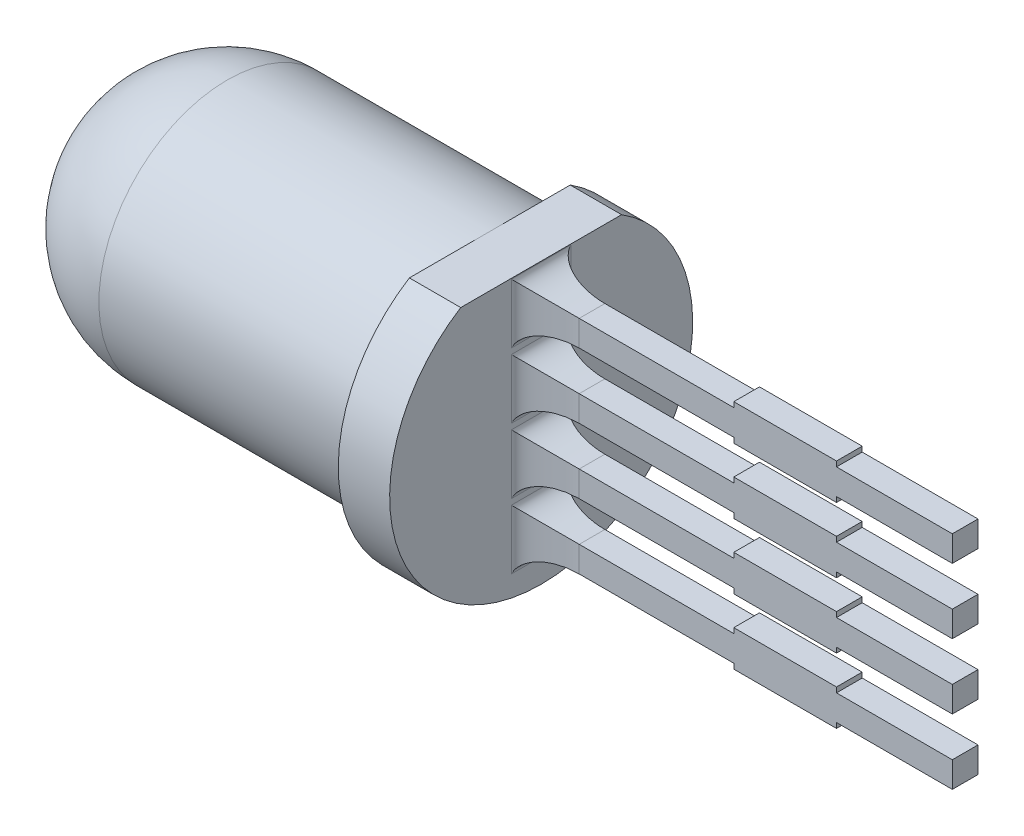
from build123d import *

# Parameters (mm, degrees)
CUT_EXTRUDE1_DEPTH              = 10.568042243
SKETCH3_W                       = 0.5
SKETCH3_H                       = 0.5
BOSS_EXTRUDE1_DEPTH             = 24.5
CUT_EXTRUDE2_DEPTH              = 25.852665853
CUT_EXTRUDE2_DEPTH_BACK         = 25.852665853
SKETCH4_W                       = 2.5
SKETCH4_H                       = 0.5
SKETCH4_W_2                     = 1
BOSS_EXTRUDE2_REACH             = 26.853
SKETCH6_W                       = 2
SKETCH6_H                       = 0.7
BOSS_EXTRUDE2_DIRECTION_2_REACH = 26.853
FILLET1_START                   = -2.4852001
FILLET1_DEPTH                   = 1.1604002
FILLET1_START_2                 = -1.2152001
FILLET1_2_DEPTH                 = 1.1604002
FILLET1_START_3                 = 0.0547999
FILLET1_3_DEPTH                 = 1.1604002
FILLET1_START_4                 = 1.3247999
FILLET1_4_DEPTH                 = 1.1604002
FILLET1_START_5                 = -2.95
FILLET1_5_DEPTH                 = 5.9
FILLET1_START_6                 = -0.25
FILLET1_6_DEPTH                 = 0.5
CUT_EXTRUDE3_DEPTH              = 25.852665853
CUT_EXTRUDE3_DEPTH_BACK         = 25.852665853
SKETCH7_W                       = 16.245
SKETCH7_H                       = 4.51


with BuildPart() as part:
    # Sketch1 → Revolve1 (revolve)
    with BuildSketch(Plane.XY, mode=Mode.PRIVATE) as revolve1_sk:
        with BuildLine():
            Line((0, 0), (0, 2.95))
            Line((0, 2.95), (-1, 2.95))
            Line((-1, 2.95), (-1, 2.5))
            Line((-1, 2.5), (-6.1106, 2.5))
            ThreePointArc((-6.1106, 2.5), (-7.878366953, 1.767766953), (-8.6106, 0))
            Line((-8.6106, 0), (0, 0))
        make_face()
    revolve(revolve1_sk.sketch.rotate(Axis((0, 0, 0), (-1, 0, 0)), 90), axis=Axis((0, 0, 0), (-1, 0, 0)))

    # Sketch2 → Cut-Extrude1 (cut, through all)
    with BuildSketch(Plane(origin=(0, 0, 0), x_dir=(0, 0, -1), z_dir=(1, 0, 0))):
        with BuildLine():
            Line((-1.566045976, 2.5), (1.566045976, 2.5))
            ThreePointArc((1.566045976, 2.5), (0, 2.95), (-1.566045976, 2.5))
        make_face()
    extrude(amount=-CUT_EXTRUDE1_DEPTH, mode=Mode.SUBTRACT)

    # Sketch3 → Boss-Extrude1 (add)
    with BuildSketch(Plane(origin=(0, 0, 0), x_dir=(0, 0, -1), z_dir=(1, 0, 0))):
        with Locations((0, 1.905)):
            Rectangle(SKETCH3_W, SKETCH3_H)
        with Locations((0, 0.635)):
            Rectangle(SKETCH3_W, SKETCH3_H)
        with Locations((0, -0.635)):
            Rectangle(SKETCH3_W, SKETCH3_H)
        with Locations((0, -1.905)):
            Rectangle(SKETCH3_W, SKETCH3_H)
    extrude(amount=BOSS_EXTRUDE1_DEPTH)

    # Sketch4 → Cut-Extrude2 (cut, two sides: drawn at the far end of the back side and taken through both)
    with BuildSketch(Plane.XY.offset(-CUT_EXTRUDE2_DEPTH_BACK)):
        with Locations((23.25, 1.905)):
            Rectangle(SKETCH4_W, SKETCH4_H)
        with Locations((24, -0.635)):
            Rectangle(SKETCH4_W_2, SKETCH4_H)
        with Locations((23.25, -1.905)):
            Rectangle(SKETCH4_W, SKETCH4_H)
    extrude(amount=CUT_EXTRUDE2_DEPTH + CUT_EXTRUDE2_DEPTH_BACK, mode=Mode.SUBTRACT)

    # Boss-Extrude2: up to this face of the body (flat: up to its plane)
    boss_extrude2_end = Plane(part.part.faces().sort_by_distance((11, 1.905, 0.25))[0])
    # Sketch6 → Boss-Extrude2 (add, up to the picked face)
    with BuildSketch(Plane.XY, mode=Mode.PRIVATE) as boss_extrude2_sk1:
        with Locations((5, 1.905)):
            Rectangle(SKETCH6_W, SKETCH6_H)
    boss_extrude2_tool1 = split(extrude(boss_extrude2_sk1.sketch, amount=BOSS_EXTRUDE2_REACH, mode=Mode.PRIVATE), bisect_by=boss_extrude2_end, keep=Keep.BOTH, mode=Mode.PRIVATE)
    # Sketch6 → Boss-Extrude2 (add, up to the picked face)
    with BuildSketch(Plane.XY, mode=Mode.PRIVATE) as boss_extrude2_sk2:
        with Locations((5, 0.635)):
            Rectangle(SKETCH6_W, SKETCH6_H)
    boss_extrude2_tool2 = split(extrude(boss_extrude2_sk2.sketch, amount=BOSS_EXTRUDE2_REACH, mode=Mode.PRIVATE), bisect_by=boss_extrude2_end, keep=Keep.BOTH, mode=Mode.PRIVATE)
    # Sketch6 → Boss-Extrude2 (add, up to the picked face)
    with BuildSketch(Plane.XY, mode=Mode.PRIVATE) as boss_extrude2_sk3:
        with Locations((5, -0.635)):
            Rectangle(SKETCH6_W, SKETCH6_H)
    boss_extrude2_tool3 = split(extrude(boss_extrude2_sk3.sketch, amount=BOSS_EXTRUDE2_REACH, mode=Mode.PRIVATE), bisect_by=boss_extrude2_end, keep=Keep.BOTH, mode=Mode.PRIVATE)
    # Sketch6 → Boss-Extrude2 (add, up to the picked face)
    with BuildSketch(Plane.XY, mode=Mode.PRIVATE) as boss_extrude2_sk4:
        with Locations((5, -1.905)):
            Rectangle(SKETCH6_W, SKETCH6_H)
    boss_extrude2_tool4 = split(extrude(boss_extrude2_sk4.sketch, amount=BOSS_EXTRUDE2_REACH, mode=Mode.PRIVATE), bisect_by=boss_extrude2_end, keep=Keep.BOTH, mode=Mode.PRIVATE)
    add(boss_extrude2_tool1.solids().sort_by(Axis((5, 1.905, 0), (0, 0, 1)))[0])
    add(boss_extrude2_tool2.solids().sort_by(Axis((5, 0.635, 0), (0, 0, 1)))[0])
    add(boss_extrude2_tool3.solids().sort_by(Axis((5, -0.635, 0), (0, 0, 1)))[0])
    add(boss_extrude2_tool4.solids().sort_by(Axis((5, -1.905, 0), (0, 0, 1)))[0])

    # Boss-Extrude2 direction 2: up to this face of the body (flat: up to its plane)
    boss_extrude2_direction_2_end = Plane(part.part.faces().sort_by_distance((11, 1.905, -0.25))[0])
    # Sketch6 → Boss-Extrude2 direction 2 (add, up to the picked face)
    with BuildSketch(Plane.XY, mode=Mode.PRIVATE) as boss_extrude2_direction_2_sk1:
        with Locations((5, 1.905)):
            Rectangle(SKETCH6_W, SKETCH6_H)
    boss_extrude2_direction_2_tool1 = split(extrude(boss_extrude2_direction_2_sk1.sketch, amount=-BOSS_EXTRUDE2_DIRECTION_2_REACH, mode=Mode.PRIVATE), bisect_by=boss_extrude2_direction_2_end, keep=Keep.BOTH, mode=Mode.PRIVATE)
    # Sketch6 → Boss-Extrude2 direction 2 (add, up to the picked face)
    with BuildSketch(Plane.XY, mode=Mode.PRIVATE) as boss_extrude2_direction_2_sk2:
        with Locations((5, 0.635)):
            Rectangle(SKETCH6_W, SKETCH6_H)
    boss_extrude2_direction_2_tool2 = split(extrude(boss_extrude2_direction_2_sk2.sketch, amount=-BOSS_EXTRUDE2_DIRECTION_2_REACH, mode=Mode.PRIVATE), bisect_by=boss_extrude2_direction_2_end, keep=Keep.BOTH, mode=Mode.PRIVATE)
    # Sketch6 → Boss-Extrude2 direction 2 (add, up to the picked face)
    with BuildSketch(Plane.XY, mode=Mode.PRIVATE) as boss_extrude2_direction_2_sk3:
        with Locations((5, -0.635)):
            Rectangle(SKETCH6_W, SKETCH6_H)
    boss_extrude2_direction_2_tool3 = split(extrude(boss_extrude2_direction_2_sk3.sketch, amount=-BOSS_EXTRUDE2_DIRECTION_2_REACH, mode=Mode.PRIVATE), bisect_by=boss_extrude2_direction_2_end, keep=Keep.BOTH, mode=Mode.PRIVATE)
    # Sketch6 → Boss-Extrude2 direction 2 (add, up to the picked face)
    with BuildSketch(Plane.XY, mode=Mode.PRIVATE) as boss_extrude2_direction_2_sk4:
        with Locations((5, -1.905)):
            Rectangle(SKETCH6_W, SKETCH6_H)
    boss_extrude2_direction_2_tool4 = split(extrude(boss_extrude2_direction_2_sk4.sketch, amount=-BOSS_EXTRUDE2_DIRECTION_2_REACH, mode=Mode.PRIVATE), bisect_by=boss_extrude2_direction_2_end, keep=Keep.BOTH, mode=Mode.PRIVATE)
    add(boss_extrude2_direction_2_tool1.solids().sort_by(Axis((5, 1.905, 0), (0, 0, -1)))[0])
    add(boss_extrude2_direction_2_tool2.solids().sort_by(Axis((5, 0.635, 0), (0, 0, -1)))[0])
    add(boss_extrude2_direction_2_tool3.solids().sort_by(Axis((5, -0.635, 0), (0, 0, -1)))[0])
    add(boss_extrude2_direction_2_tool4.solids().sort_by(Axis((5, -1.905, 0), (0, 0, -1)))[0])

    # Fillet1: read off the stored shape, not the designer's step
    # Fillet1 outline → Fillet1 (add)
    with BuildSketch(Plane(origin=(0, 0, 0), x_dir=(1, 0, 0), z_dir=(0, 1, 0)).offset(FILLET1_START)):
        with BuildLine():
            Line((0, 0.5802), (0, 0.25))
            Line((0, 0.25), (0.9906, 0.25))
            add(Edge.make_bspline(
                [(0.9906, 0.25), (0, 0.25), (0, 0.5802)],
                knots=[0, 0, 0, 1, 1, 1], degree=2, weights=[1, 0.707106781, 1]))
        make_face()
        with BuildLine():
            add(Edge.make_bspline(
                [(0.9906, -0.25), (0, -0.25), (0, -0.5802)],
                knots=[0, 0, 0, 1, 1, 1], degree=2, weights=[1, 0.707106781, 1]))
            Line((0.9906, -0.25), (0, -0.25))
            Line((0, -0.25), (0, -0.5802))
        make_face()
    extrude(amount=FILLET1_DEPTH)

    # Fillet1 2 outline → Fillet1 2 (add)
    with BuildSketch(Plane(origin=(0, 0, 0), x_dir=(1, 0, 0), z_dir=(0, 1, 0)).offset(FILLET1_START_2)):
        with BuildLine():
            Line((0, 0.5802), (0, 0.25))
            Line((0, 0.25), (0.9906, 0.25))
            add(Edge.make_bspline(
                [(0.9906, 0.25), (0, 0.25), (0, 0.5802)],
                knots=[0, 0, 0, 1, 1, 1], degree=2, weights=[1, 0.707106781, 1]))
        make_face()
        with BuildLine():
            add(Edge.make_bspline(
                [(0.9906, -0.25), (0, -0.25), (0, -0.5802)],
                knots=[0, 0, 0, 1, 1, 1], degree=2, weights=[1, 0.707106781, 1]))
            Line((0.9906, -0.25), (0, -0.25))
            Line((0, -0.25), (0, -0.5802))
        make_face()
    extrude(amount=FILLET1_2_DEPTH)

    # Fillet1 3 outline → Fillet1 3 (add)
    with BuildSketch(Plane(origin=(0, 0, 0), x_dir=(1, 0, 0), z_dir=(0, 1, 0)).offset(FILLET1_START_3)):
        with BuildLine():
            Line((0, 0.5802), (0, 0.25))
            Line((0, 0.25), (0.9906, 0.25))
            add(Edge.make_bspline(
                [(0.9906, 0.25), (0, 0.25), (0, 0.5802)],
                knots=[0, 0, 0, 1, 1, 1], degree=2, weights=[1, 0.707106781, 1]))
        make_face()
        with BuildLine():
            add(Edge.make_bspline(
                [(0.9906, -0.25), (0, -0.25), (0, -0.5802)],
                knots=[0, 0, 0, 1, 1, 1], degree=2, weights=[1, 0.707106781, 1]))
            Line((0.9906, -0.25), (0, -0.25))
            Line((0, -0.25), (0, -0.5802))
        make_face()
    extrude(amount=FILLET1_3_DEPTH)

    # Fillet1 4 outline → Fillet1 4 (add)
    with BuildSketch(Plane(origin=(0, 0, 0), x_dir=(1, 0, 0), z_dir=(0, 1, 0)).offset(FILLET1_START_4)):
        with BuildLine():
            Line((0, 0.5802), (0, 0.25))
            Line((0, 0.25), (0.9906, 0.25))
            add(Edge.make_bspline(
                [(0.9906, 0.25), (0, 0.25), (0, 0.5802)],
                knots=[0, 0, 0, 1, 1, 1], degree=2, weights=[1, 0.707106781, 1]))
        make_face()
        with BuildLine():
            add(Edge.make_bspline(
                [(0.9906, -0.25), (0, -0.25), (0, -0.5802)],
                knots=[0, 0, 0, 1, 1, 1], degree=2, weights=[1, 0.707106781, 1]))
            Line((0.9906, -0.25), (0, -0.25))
            Line((0, -0.25), (0, -0.5802))
        make_face()
    extrude(amount=FILLET1_4_DEPTH)

    # Fillet1 5 outline → Fillet1 5 (cut)
    with BuildSketch(Plane.XY.offset(FILLET1_START_5)):
        with BuildLine():
            add(Edge.make_bspline(
                [(0.9906, -1.655), (0, -1.655), (0, -1.3248)],
                knots=[0, 0, 0, 1, 1, 1], degree=2, weights=[1, 0.707106781, 1]))
            Line((0.9906, -1.655), (2, -1.655))
            Line((2, -1.655), (2, -0.885))
            Line((2, -0.885), (0.9906, -0.885))
            add(Edge.make_bspline(
                [(0.9906, -0.885), (0, -0.885), (0, -1.2152)],
                knots=[0, 0, 0, 1, 1, 1], degree=2, weights=[1, 0.707106781, 1]))
            Line((0, -1.2152), (0, -1.3248))
        make_face()
        with BuildLine():
            Line((2, -4), (2, -2.155))
            Line((2, -2.155), (0.9906, -2.155))
            add(Edge.make_bspline(
                [(0.9906, -2.155), (0, -2.155), (0, -2.4852)],
                knots=[0, 0, 0, 1, 1, 1], degree=2, weights=[1, 0.707106781, 1]))
            Line((0, -2.4852), (0, -4))
            Line((0, -4), (2, -4))
        make_face()
        with BuildLine():
            Line((0.9906, -0.385), (2, -0.385))
            Line((2, -0.385), (2, 0.385))
            Line((2, 0.385), (0.9906, 0.385))
            add(Edge.make_bspline(
                [(0.9906, 0.385), (0, 0.385), (0, 0.0548)],
                knots=[0, 0, 0, 1, 1, 1], degree=2, weights=[1, 0.707106781, 1]))
            Line((0, 0.0548), (0, -0.0548))
            add(Edge.make_bspline(
                [(0.9906, -0.385), (0, -0.385), (0, -0.0548)],
                knots=[0, 0, 0, 1, 1, 1], degree=2, weights=[1, 0.707106781, 1]))
        make_face()
        with BuildLine():
            Line((0.9906, 0.885), (2, 0.885))
            Line((2, 0.885), (2, 1.655))
            Line((2, 1.655), (0.9906, 1.655))
            add(Edge.make_bspline(
                [(0.9906, 1.655), (0, 1.655), (0, 1.3248)],
                knots=[0, 0, 0, 1, 1, 1], degree=2, weights=[1, 0.707106781, 1]))
            Line((0, 1.3248), (0, 1.2152))
            add(Edge.make_bspline(
                [(0.9906, 0.885), (0, 0.885), (0, 1.2152)],
                knots=[0, 0, 0, 1, 1, 1], degree=2, weights=[1, 0.707106781, 1]))
        make_face()
        with BuildLine():
            Line((0.9906, 2.155), (2, 2.155))
            Line((2, 2.155), (2, 4))
            Line((2, 4), (0, 4))
            Line((0, 4), (0, 2.4852))
            add(Edge.make_bspline(
                [(0.9906, 2.155), (0, 2.155), (0, 2.4852)],
                knots=[0, 0, 0, 1, 1, 1], degree=2, weights=[1, 0.707106781, 1]))
        make_face()
    extrude(amount=FILLET1_5_DEPTH, mode=Mode.SUBTRACT)

    # Fillet1 6 outline → Fillet1 6 (add)
    with BuildSketch(Plane.XY.offset(FILLET1_START_6)):
        with BuildLine():
            Line((0, -1.655), (0.9906, -1.655))
            add(Edge.make_bspline(
                [(0.9906, -1.655), (0, -1.655), (0, -1.3248)],
                knots=[0, 0, 0, 1, 1, 1], degree=2, weights=[1, 0.707106781, 1]))
            Line((0, -1.3248), (0, -1.655))
        make_face()
        with BuildLine():
            Line((0, -0.885), (0, -1.2152))
            add(Edge.make_bspline(
                [(0.9906, -0.885), (0, -0.885), (0, -1.2152)],
                knots=[0, 0, 0, 1, 1, 1], degree=2, weights=[1, 0.707106781, 1]))
            Line((0.9906, -0.885), (0, -0.885))
        make_face()
        with BuildLine():
            Line((0.9906, -2.155), (0, -2.155))
            Line((0, -2.155), (0, -2.4852))
            add(Edge.make_bspline(
                [(0.9906, -2.155), (0, -2.155), (0, -2.4852)],
                knots=[0, 0, 0, 1, 1, 1], degree=2, weights=[1, 0.707106781, 1]))
        make_face()
        with BuildLine():
            Line((0, -0.0548), (0, -0.385))
            Line((0, -0.385), (0.9906, -0.385))
            add(Edge.make_bspline(
                [(0.9906, -0.385), (0, -0.385), (0, -0.0548)],
                knots=[0, 0, 0, 1, 1, 1], degree=2, weights=[1, 0.707106781, 1]))
        make_face()
        with BuildLine():
            add(Edge.make_bspline(
                [(0.9906, 0.385), (0, 0.385), (0, 0.0548)],
                knots=[0, 0, 0, 1, 1, 1], degree=2, weights=[1, 0.707106781, 1]))
            Line((0.9906, 0.385), (0, 0.385))
            Line((0, 0.385), (0, 0.0548))
        make_face()
        with BuildLine():
            Line((0, 0.885), (0.9906, 0.885))
            add(Edge.make_bspline(
                [(0.9906, 0.885), (0, 0.885), (0, 1.2152)],
                knots=[0, 0, 0, 1, 1, 1], degree=2, weights=[1, 0.707106781, 1]))
            Line((0, 1.2152), (0, 0.885))
        make_face()
        with BuildLine():
            add(Edge.make_bspline(
                [(0.9906, 1.655), (0, 1.655), (0, 1.3248)],
                knots=[0, 0, 0, 1, 1, 1], degree=2, weights=[1, 0.707106781, 1]))
            Line((0.9906, 1.655), (0, 1.655))
            Line((0, 1.655), (0, 1.3248))
        make_face()
        with BuildLine():
            Line((0, 2.155), (0.9906, 2.155))
            add(Edge.make_bspline(
                [(0.9906, 2.155), (0, 2.155), (0, 2.4852)],
                knots=[0, 0, 0, 1, 1, 1], degree=2, weights=[1, 0.707106781, 1]))
            Line((0, 2.4852), (0, 2.155))
        make_face()
    extrude(amount=FILLET1_6_DEPTH)

    # Sketch7 → Cut-Extrude3 (cut, two sides: drawn at the far end of the back side and taken through both)
    with BuildSketch(Plane.XY.offset(-CUT_EXTRUDE3_DEPTH_BACK)):
        with Locations((16.3775, 0)):
            Rectangle(SKETCH7_W, SKETCH7_H)
    extrude(amount=CUT_EXTRUDE3_DEPTH + CUT_EXTRUDE3_DEPTH_BACK, mode=Mode.SUBTRACT)


solid = part.part
